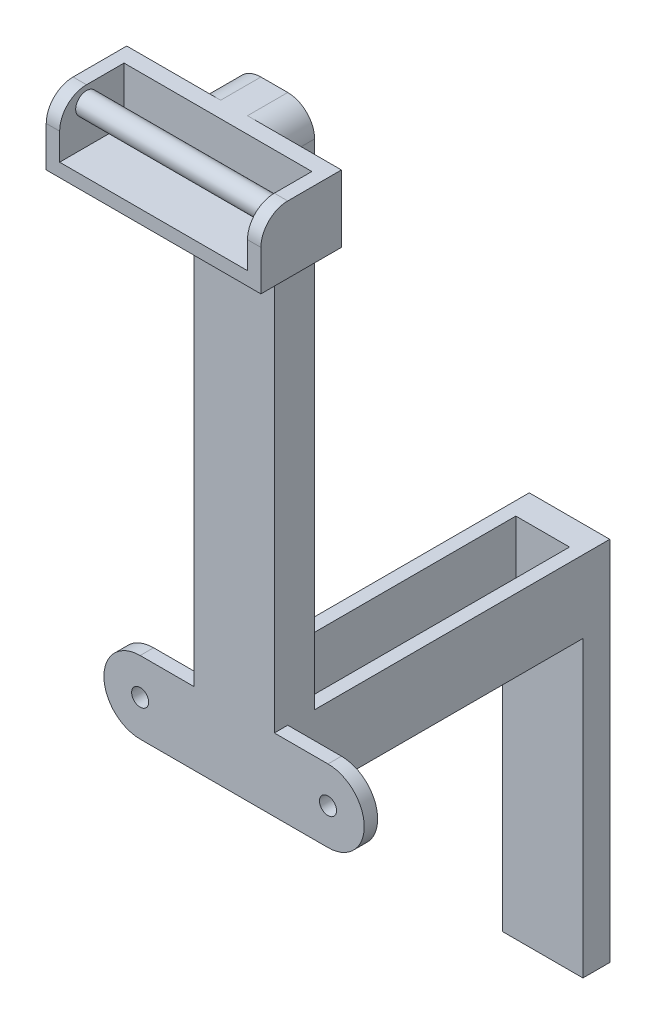
from build123d import *

# Parameters (mm, degrees)
EXTRUDE1_DEPTH                  = 15
FILLET1_R                       = 10
EXTRUDE2_DEPTH                  = 10
SKETCH3_W                       = 80
SKETCH3_H                       = 25
EXTRUDE3_DEPTH                  = 30
SKETCH5_W                       = 70
SKETCH5_H                       = 20
EXTRUDE4_DEPTH                  = 24
FILLET2_R                       = 10
EXTRUDE5_REACH                  = 432.349
SKETCH6_R                       = 4.029178008
SKETCH7_W                       = 30
SKETCH7_H                       = 263.372286267
EXTRUDE6_DEPTH                  = 427.91910061
EXTRUDE7_DEPTH                  = 100
SKETCH9_W                       = 30
SKETCH9_H                       = 136.58118173
EXTRUDE8_DEPTH                  = 10
F_1_4_0_25_DIAMETER_HOLE1_D     = 6.35
F_1_4_0_25_DIAMETER_HOLE1_DEPTH = 10
F_1_4_0_25_DIAMETER_HOLE1_TIP   = 1.907732465


with BuildPart() as part:
    # Sketch1 → Extrude1 (new body)
    with BuildSketch(Plane.XY):
        with BuildLine():
            Line((0, -62.834984228), (30, -62.834984228))
            Line((30, -62.834984228), (30, 198.565015772))
            Line((30, 198.565015772), (50, 198.565015772))
            ThreePointArc((50, 198.565015772), (63.5, 212.065015772), (50, 225.565015772))
            Line((50, 225.565015772), (30, 225.565015772))
            Line((30, 225.565015772), (30, 419.765015772))
            Line((30, 419.765015772), (0, 419.765015772))
            Line((0, 419.765015772), (0, 225.565015772))
            Line((0, 225.565015772), (-20, 225.565015772))
            ThreePointArc((-20, 225.565015772), (-33.5, 212.065015772), (-20, 198.565015772))
            Line((-20, 198.565015772), (0, 198.565015772))
            Line((0, 198.565015772), (0, -62.834984228))
        make_face()
    extrude(amount=EXTRUDE1_DEPTH)

    # Fillet1
    fillet1_edges = [part.edges().sort_by_distance(p)[0] for p in [
        (30, -62.834984228, 7.5),
        (0, -62.834984228, 7.5),
        (0, 419.765015772, 7.5),
        (30, 419.765015772, 7.5),
    ]]
    fillet(fillet1_edges, radius=FILLET1_R)

    # Sketch2 → Extrude2 (cut)
    with BuildSketch(Plane(origin=(0, 0, 0), x_dir=(-1, 0, 0), z_dir=(0, 0, -1))):
        with BuildLine():
            Line((-50, 225.565015772), (-30, 225.565015772))
            Line((-30, 225.565015772), (-30, 198.565015772))
            Line((-30, 198.565015772), (-50, 198.565015772))
            ThreePointArc((-50, 198.565015772), (-63.5, 212.065015772), (-50, 225.565015772))
        make_face()
        with BuildLine():
            Line((0, 198.565015772), (20, 198.565015772))
            ThreePointArc((20, 198.565015772), (33.5, 212.065015772), (20, 225.565015772))
            Line((20, 225.565015772), (0, 225.565015772))
            Line((0, 225.565015772), (0, 198.565015772))
        make_face()
    extrude(amount=-EXTRUDE2_DEPTH, mode=Mode.SUBTRACT)

    # Sketch3 → Extrude3 (add)
    with BuildSketch(Plane.XY.offset(15)):
        with Locations((15, 407.265015772)):
            Rectangle(SKETCH3_W, SKETCH3_H)
    extrude(amount=EXTRUDE3_DEPTH)

    # Sketch5 → Extrude4 (cut)
    with BuildSketch(Plane.XY.offset(45)):
        with Locations((15, 409.765015772)):
            Rectangle(SKETCH5_W, SKETCH5_H)
    extrude(amount=-EXTRUDE4_DEPTH, mode=Mode.SUBTRACT)

    # Fillet2
    fillet2_edges = [part.edges().sort_by_distance(p)[0] for p in [
        (-22.5, 419.765015772, 45),
        (52.5, 419.765015772, 45),
    ]]
    fillet(fillet2_edges, radius=FILLET2_R)

    # Sketch6 → Extrude5 (add, up to next)
    with BuildSketch(Plane.ZY.offset(-50), mode=Mode.PRIVATE) as extrude5_sk1:
        with Locations((35, 413.847695375)):
            Circle(SKETCH6_R)
    extrude5_tool1 = extrude(extrude5_sk1.sketch, amount=EXTRUDE5_REACH, mode=Mode.PRIVATE) - part.part
    add(extrude5_tool1.solids().sort_by_distance((50, 413.847695, 35))[0])

    # Sketch7 → Extrude6 (cut, through all)
    with BuildSketch(Plane(origin=(0, 0, 0), x_dir=(-1, 0, 0), z_dir=(0, 0, -1))):
        with Locations((-15, 66.878872639)):
            Rectangle(SKETCH7_W, SKETCH7_H)
    extrude(amount=-EXTRUDE6_DEPTH, mode=Mode.SUBTRACT)

    # Sketch8 → Extrude7 (add)
    with BuildSketch(Plane(origin=(0, 0, 0), x_dir=(-1, 0, 0), z_dir=(0, 0, -1))):
        Polygon((-30, 198.565015772), (0, 198.565015772), (0, 225.565015772), (-5, 225.565015772), (-5, 203.565015772), (-25, 203.565015772), (-25, 225.565015772), (-30, 225.565015772), align=None)
    extrude(amount=EXTRUDE7_DEPTH)

    # Sketch9 → Extrude8 (add)
    with BuildSketch(Plane(origin=(0, 0, -100), x_dir=(-1, 0, 0), z_dir=(0, 0, -1))):
        with Locations((-15, 157.274424907)):
            Rectangle(SKETCH9_W, SKETCH9_H)
    extrude(amount=EXTRUDE8_DEPTH)

    # 1/4 (0.25) Diameter Hole1
    with Locations(Plane(origin=(-20, 212.065015772, 10), x_dir=(-1, 0, 0), z_dir=(0, 0, -1))):
        with Locations((0, 0), (-70, 0)):
            Hole(F_1_4_0_25_DIAMETER_HOLE1_D / 2, depth=F_1_4_0_25_DIAMETER_HOLE1_DEPTH)
            with Locations((0, 0, -(F_1_4_0_25_DIAMETER_HOLE1_DEPTH + F_1_4_0_25_DIAMETER_HOLE1_TIP / 2))):  # 118° drill point
                Cone(0, F_1_4_0_25_DIAMETER_HOLE1_D / 2, F_1_4_0_25_DIAMETER_HOLE1_TIP, mode=Mode.SUBTRACT)


solid = part.part
